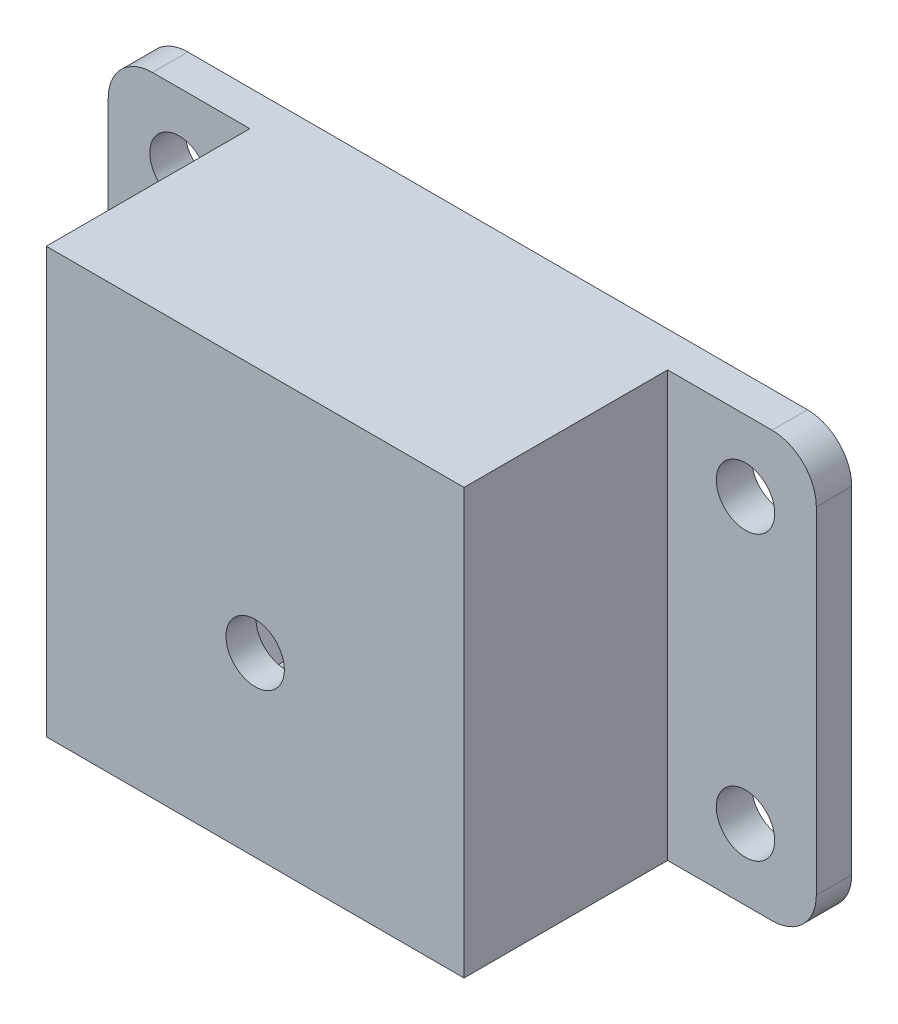
from build123d import *

# Parameters (mm, degrees)
SKETCH1_R           = 1.65
BOSS_EXTRUDE1_DEPTH = 2
BOSS_EXTRUDE2_DEPTH = 5.5
SKETCH3_W           = 23.6
SKETCH3_H           = 24
SKETCH3_R           = 1.65
BOSS_EXTRUDE3_DEPTH = 6
CUT_EXTRUDE1_START  = -1.7
CUT_EXTRUDE1_DEPTH  = 2.6
FILLET1_R           = 2.5


with BuildPart() as part:
    # Sketch1 → Boss-Extrude1 (new body)
    with BuildSketch(Plane(origin=(0, 0, 0), x_dir=(0, 1, 0), z_dir=(0, 0, 1))):
        Polygon((-24, 12.4), (-4, 12.4), (-4, 28), (-24, 28), (-24, 40), (0, 40), (0, 0), (-24, 0), align=None)
        with Locations((-20, 4)):
            Circle(SKETCH1_R, mode=Mode.SUBTRACT)
        with Locations((-4, 4)):
            Circle(SKETCH1_R, mode=Mode.SUBTRACT)
        with Locations((-4, 36)):
            Circle(SKETCH1_R, mode=Mode.SUBTRACT)
        with Locations((-20, 36)):
            Circle(SKETCH1_R, mode=Mode.SUBTRACT)
    extrude(amount=BOSS_EXTRUDE1_DEPTH)

    # Sketch2 → Boss-Extrude2 (add)
    with BuildSketch(Plane.XY.offset(2)):
        Polygon((-28, -24), (-28, -4), (-12.4, -4), (-12.4, -24), (-8.4, -24), (-8.4, 0), (-32, 0), (-32, -24), align=None)
    extrude(amount=BOSS_EXTRUDE2_DEPTH)

    # Sketch3 → Boss-Extrude3 (add)
    with BuildSketch(Plane.XY.offset(7.5)):
        with Locations((-20.2, -12)):
            Rectangle(SKETCH3_W, SKETCH3_H)
        with Locations((-20.2, -14)):
            Circle(SKETCH3_R, mode=Mode.SUBTRACT)
    extrude(amount=BOSS_EXTRUDE3_DEPTH)

    # Sketch4 → Cut-Extrude1 (cut)
    with BuildSketch(Plane.XY.offset(13.5).offset(CUT_EXTRUDE1_START)):
        Polygon((-16.851368439, -14), (-18.525684219, -11.1), (-21.874315781, -11.1), (-23.548631561, -14), (-21.874315781, -16.9), (-18.525684219, -16.9), align=None)
    extrude(amount=-CUT_EXTRUDE1_DEPTH, mode=Mode.SUBTRACT)

    # Fillet1
    fillet1_edges = [part.edges().sort_by_distance(p)[0] for p in [
        (0, -24, 1),
        (0, 0, 1),
        (-40, 0, 1),
        (-40, -24, 1),
    ]]
    fillet(fillet1_edges, radius=FILLET1_R)


solid = part.part
